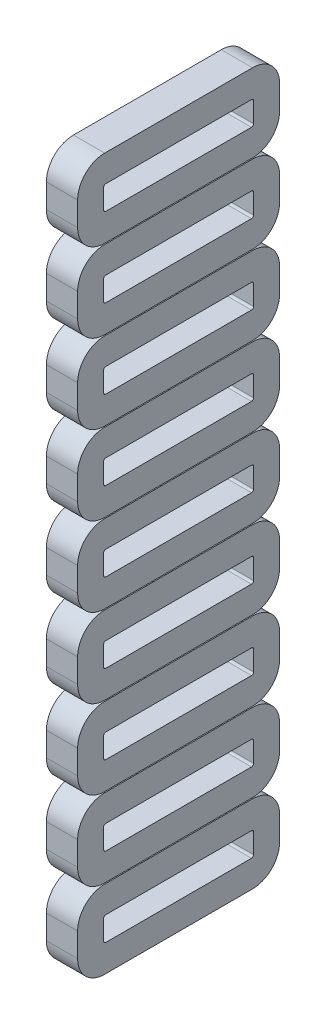
from build123d import *

# Parameters (mm, degrees)
BOSS_EXTRUDE1_DEPTH = 7.5
LPATTERN1_COUNT     = 9
LPATTERN1_PITCH     = 38


# Read off the part's stored shape, not the designer's step: Ironless_UX_9_CoilUnit_CAD_160603.stp<1>
with BuildPart() as part:
    # Sketch1 → Boss-Extrude1 (new, symmetric)
    with BuildSketch(Plane(origin=(0, 0, 0), x_dir=(0, 0, -1), z_dir=(1, 0, 0))):
        with BuildLine():
            Line((-0.8, 319.25), (70.2, 319.25))
            ThreePointArc((70.2, 319.25), (79.392388155, 323.057611845), (83.2, 332.25))
            Line((83.2, 332.25), (83.2, 343.75))
            ThreePointArc((83.2, 343.75), (79.392388155, 352.942388155), (70.2, 356.75))
            Line((70.2, 356.75), (-0.8, 356.75))
            ThreePointArc((-0.8, 356.75), (-9.992388155, 352.942388155), (-13.8, 343.75))
            Line((-13.8, 343.75), (-13.8, 332.25))
            ThreePointArc((-13.8, 332.25), (-9.992388155, 323.057611845), (-0.8, 319.25))
        make_face()
        with BuildLine():
            Line((-0.3, 332.25), (69.7, 332.25))
            ThreePointArc((69.7, 332.25), (70.407106781, 332.542893219), (70.7, 333.25))
            Line((70.7, 333.25), (70.7, 342.75))
            ThreePointArc((70.7, 342.75), (70.407106781, 343.457106781), (69.7, 343.75))
            Line((69.7, 343.75), (-0.3, 343.75))
            ThreePointArc((-0.3, 343.75), (-1.007106781, 343.457106781), (-1.3, 342.75))
            Line((-1.3, 342.75), (-1.3, 333.25))
            ThreePointArc((-1.3, 333.25), (-1.007106781, 332.542893219), (-0.3, 332.25))
        make_face(mode=Mode.SUBTRACT)
    extrude(amount=BOSS_EXTRUDE1_DEPTH, both=True)


with BuildPart() as lpattern1_1:
    # LPattern1: pattern copy
    add(part.part.moved(Location(Vector(0, -1, 0) * (1 * LPATTERN1_PITCH))))


with BuildPart() as lpattern1_2:
    # LPattern1: pattern copy
    add(part.part.moved(Location(Vector(0, -1, 0) * (2 * LPATTERN1_PITCH))))


with BuildPart() as lpattern1_3:
    # LPattern1: pattern copy
    add(part.part.moved(Location(Vector(0, -1, 0) * (3 * LPATTERN1_PITCH))))


with BuildPart() as lpattern1_4:
    # LPattern1: pattern copy
    add(part.part.moved(Location(Vector(0, -1, 0) * (4 * LPATTERN1_PITCH))))


with BuildPart() as lpattern1_5:
    # LPattern1: pattern copy
    add(part.part.moved(Location(Vector(0, -1, 0) * (5 * LPATTERN1_PITCH))))


with BuildPart() as lpattern1_6:
    # LPattern1: pattern copy
    add(part.part.moved(Location(Vector(0, -1, 0) * (6 * LPATTERN1_PITCH))))


with BuildPart() as lpattern1_7:
    # LPattern1: pattern copy
    add(part.part.moved(Location(Vector(0, -1, 0) * (7 * LPATTERN1_PITCH))))


with BuildPart() as lpattern1_8:
    # LPattern1: pattern copy
    add(part.part.moved(Location(Vector(0, -1, 0) * (8 * LPATTERN1_PITCH))))


solid = Compound([part.part, lpattern1_1.part, lpattern1_2.part, lpattern1_3.part, lpattern1_4.part, lpattern1_5.part, lpattern1_6.part, lpattern1_7.part, lpattern1_8.part])
